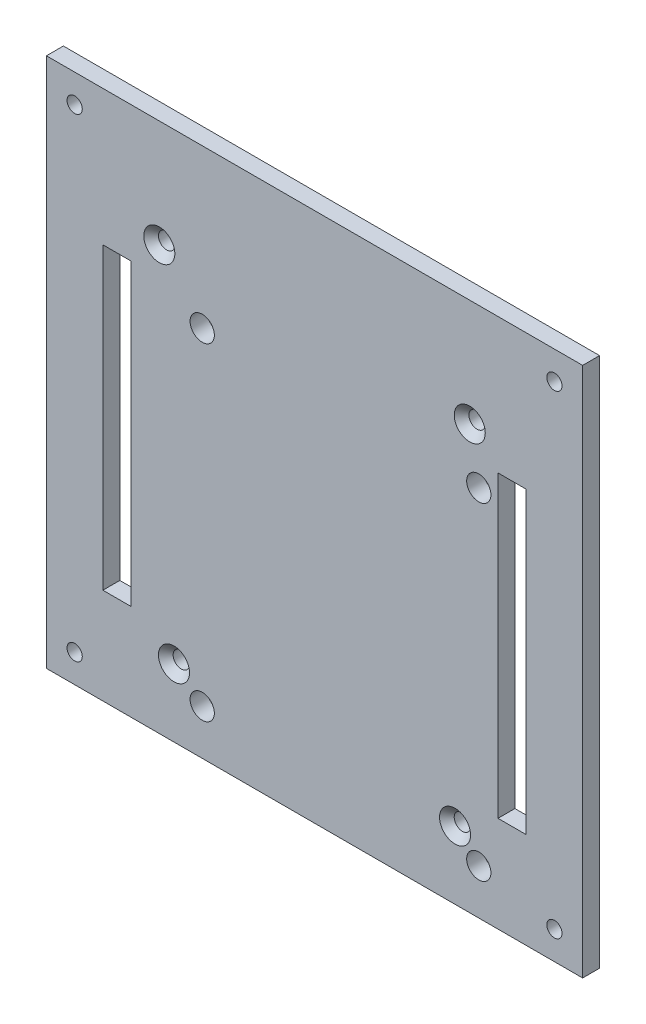
from build123d import *

# Parameters (mm, degrees)
CROQUIS1_W                                           = 95
CROQUIS1_H                                           = 82
SALIENTE_EXTRUIR1_DEPTH                              = 3
AVELLANADO_PARA_TORNILLO_CON_CABEZA_PLAN_D           = 2.9
AVELLANADO_PARA_TORNILLO_CON_CABEZA_PLAN_CSINK_D     = 5.5
AVELLANADO_PARA_TORNILLO_CON_CABEZA_PLAN_CSINK_ANGLE = 90
CORTAR_EXTRUIR1_REACH                                = 127.531
CROQUIS6_W                                           = 5
CROQUIS6_H                                           = 53
CROQUIS7_W                                           = 95
CROQUIS7_H                                           = 3
SALIENTE_EXTRUIR2_DEPTH                              = 6
CROQUIS8_W                                           = 95
CROQUIS8_H                                           = 3
SALIENTE_EXTRUIR3_DEPTH                              = 6
TALADRO_DE_MARGEN_PARA_M2_51_D                       = 2.7
TALADRO_DE_MARGEN_PARA_M41_D                         = 4.3


with BuildPart() as part:
    # Croquis1 → Saliente-Extruir1 (new body)
    with BuildSketch(Plane.XY):
        with Locations((47.5, 41)):
            Rectangle(CROQUIS1_W, CROQUIS1_H)
    extrude(amount=SALIENTE_EXTRUIR1_DEPTH)

    # Avellanado para tornillo con cabeza plana avellanada de M2.51 (through all)
    with Locations(Plane(origin=(20, 69, 3), x_dir=(1, 0, 0), z_dir=(0, 0, 1))):
        with Locations((0, 0), (55, 0), (52.4, -63), (2.6, -63)):
            CounterSinkHole(AVELLANADO_PARA_TORNILLO_CON_CABEZA_PLAN_D / 2, AVELLANADO_PARA_TORNILLO_CON_CABEZA_PLAN_CSINK_D / 2, counter_sink_angle=AVELLANADO_PARA_TORNILLO_CON_CABEZA_PLAN_CSINK_ANGLE)

    # Croquis6 → Cortar-Extruir1 (cut, up to next)
    with BuildSketch(Plane.XY.offset(3), mode=Mode.PRIVATE) as cortar_extruir1_sk1:
        with Locations((12.5, 37.5)):
            Rectangle(CROQUIS6_W, CROQUIS6_H)
    cortar_extruir1_tool1 = extrude(cortar_extruir1_sk1.sketch, amount=-CORTAR_EXTRUIR1_REACH, mode=Mode.PRIVATE) & part.part
    # Croquis6 → Cortar-Extruir1 (cut, up to next)
    with BuildSketch(Plane.XY.offset(3), mode=Mode.PRIVATE) as cortar_extruir1_sk2:
        with Locations((82.5, 37.5)):
            Rectangle(CROQUIS6_W, CROQUIS6_H)
    cortar_extruir1_tool2 = extrude(cortar_extruir1_sk2.sketch, amount=-CORTAR_EXTRUIR1_REACH, mode=Mode.PRIVATE) & part.part
    add(cortar_extruir1_tool1.solids().sort_by_distance((12.5, 37.5, 3))[0], mode=Mode.SUBTRACT)
    add(cortar_extruir1_tool2.solids().sort_by_distance((82.5, 37.5, 3))[0], mode=Mode.SUBTRACT)

    # Croquis7 → Saliente-Extruir2 (add)
    with BuildSketch(Plane(origin=(0, 82, 0), x_dir=(1, 0, 0), z_dir=(0, 1, 0))):
        with Locations((47.5, -1.5)):
            Rectangle(CROQUIS7_W, CROQUIS7_H)
    extrude(amount=SALIENTE_EXTRUIR2_DEPTH)

    # Croquis8 → Saliente-Extruir3 (add)
    with BuildSketch(Plane.XZ):
        with Locations((47.5, 1.5)):
            Rectangle(CROQUIS8_W, CROQUIS8_H)
    extrude(amount=SALIENTE_EXTRUIR3_DEPTH)

    # Taladro de margen para M2.51 (through all)
    with Locations(Plane(origin=(5, 83, 3), x_dir=(1, 0, 0), z_dir=(0, 0, 1))):
        with Locations((0, 0), (0, -84), (85, -84), (85, 0)):
            Hole(TALADRO_DE_MARGEN_PARA_M2_51_D / 2)

    # Taladro de margen para M41 (through all)
    with Locations(Plane(origin=(27.6, 2, 3), x_dir=(1, 0, 0), z_dir=(0, 0, 1))):
        with Locations((0, 0), (49, 0), (0, 58), (49, 58)):
            Hole(TALADRO_DE_MARGEN_PARA_M41_D / 2)


solid = part.part
